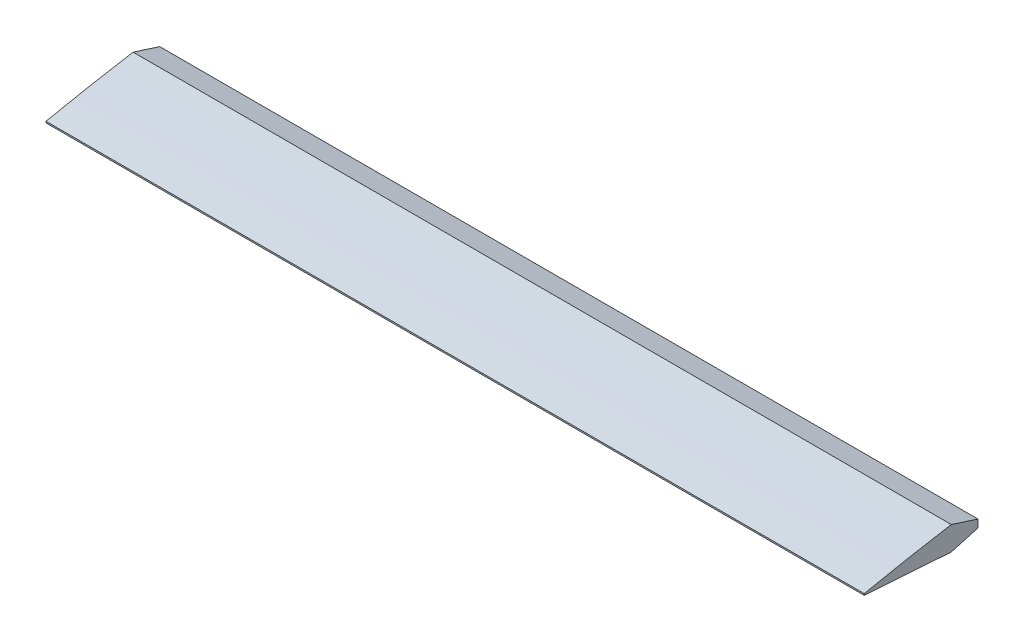
from build123d import *

# Parameters (mm, degrees)
EXTERIOR_DEPTH          = 89
BOSS_EXTRUDE1_DEPTH     = 15
CUT_EXTRUDE1_DEPTH      = 187.402789831
BOSS_EXTRUDE2_DEPTH     = 170
CUT_EXTRUDE6_DEPTH      = 195.066998874
CUT_EXTRUDE2_DEPTH      = 194.966819744
CUT_EXTRUDE2_DEPTH_BACK = 194.966819744
SKETCH13_R              = 3.25
SKETCH19_W              = 37
SKETCH19_H              = 36
CUT_EXTRUDE7_DEPTH      = 23
CUT_EXTRUDE8_DEPTH      = 266.663791417
CUT_EXTRUDE9_DEPTH      = 158.83115621


with BuildPart() as part:
    # Sketch4 → Exterior (new body)
    with BuildSketch(Plane.XY):
        with BuildLine():
            Line((-30.310889132, 17.5), (30.310889132, 17.5))
            ThreePointArc((30.310889132, 17.5), (0, 35), (-30.310889132, 17.5))
        make_face()
    extrude(amount=EXTERIOR_DEPTH)

    # Sketch5 → Boss-Extrude1 (add)
    with BuildSketch(Plane(origin=(0, 0, 0), x_dir=(-1, 0, 0), z_dir=(0, 0, -1))):
        with BuildLine():
            Line((23.12466216, 17.5), (-23.12466216, 17.5))
            ThreePointArc((-23.12466216, 17.5), (0, 29), (23.12466216, 17.5))
        make_face()
    extrude(amount=BOSS_EXTRUDE1_DEPTH)

    # Sketch8 → Loft9 section 0
    with BuildSketch(Plane(origin=(80, 0, 0), x_dir=(0, 0, -1), z_dir=(1, 0, 0))):
        with BuildLine():
            Line((-89, 21.388673285), (-89, 21.157289024))
            add(Edge.make_bspline(
                [(-89, 21.388673285), (-87.517590216, 21.692439314), (-84.55666408, 22.299173554), (-78.629726947, 23.410490963), (-71.217063181, 24.641831569), (-62.315979948, 25.916239067), (-53.416365024, 26.979047829), (-44.512891772, 27.757252313), (-35.611446145, 28.284249753), (-28.184700481, 28.373454674), (-22.249157522, 28.127729724), (-17.793860325, 27.767671666), (-13.332938365, 27.197496306), (-9.62034211, 26.495369454), (-6.660587516, 25.701015566), (-4.416675535, 24.978830377), (-2.51552544, 24.137376162), (-0.875610556, 23.117206005), (0.554450875, 21.352966349), (-0.931001928, 19.802231536), (-2.540242561, 19.094955092), (-4.433028592, 18.557703614), (-6.669552992, 18.172492853), (-9.641153104, 17.843758377), (-13.350431468, 17.590735708), (-17.804318711, 17.489291467), (-22.255027214, 17.503428063), (-28.18850674, 17.634400274), (-35.606048519, 17.870077207), (-44.505998121, 18.280226492), (-53.403367011, 18.813318665), (-62.302244976, 19.367425301), (-71.202644497, 19.928300878), (-78.617203737, 20.444864827), (-84.55068004, 20.843300056), (-87.516825449, 21.052621243), (-89, 21.157289024)],
                knots=[0, 0, 0, 0, 0.02501249, 0.049959286, 0.099672925, 0.14920632, 0.198581097, 0.24780517, 0.296916575, 0.345952722, 0.370491626, 0.395091204, 0.419814796, 0.444798575, 0.457489819, 0.470406405, 0.483879409, 0.49126412, 0.503458853, 0.513609129, 0.520450991, 0.533235388, 0.545691039, 0.558031884, 0.582609167, 0.607134742, 0.63165208, 0.656174272, 0.705233949, 0.754320379, 0.803437364, 0.852566096, 0.901700994, 0.950848809, 0.975422717, 1, 1, 1, 1], degree=3))
        make_face()
    # Sketch9 → Loft9 section 1
    with BuildSketch(Plane(origin=(-80, 0, 0), x_dir=(0, 0, -1), z_dir=(1, 0, 0))):
        with BuildLine():
            Line((-89, 21.388673285), (-89, 21.157289024))
            add(Edge.make_bspline(
                [(-89, 21.388673285), (-87.517590216, 21.692439314), (-84.55666408, 22.299173554), (-78.629726947, 23.410490963), (-71.217063181, 24.641831569), (-62.315979948, 25.916239067), (-53.416365024, 26.979047829), (-44.512891772, 27.757252313), (-35.611446145, 28.284249753), (-28.184700481, 28.373454674), (-22.249157522, 28.127729724), (-17.793860325, 27.767671666), (-13.332938365, 27.197496306), (-9.62034211, 26.495369454), (-6.660587516, 25.701015566), (-4.416675535, 24.978830377), (-2.51552544, 24.137376162), (-0.875610556, 23.117206005), (0.554450875, 21.352966349), (-0.931001928, 19.802231536), (-2.540242561, 19.094955092), (-4.433028592, 18.557703614), (-6.669552992, 18.172492853), (-9.641153104, 17.843758377), (-13.350431468, 17.590735708), (-17.804318711, 17.489291467), (-22.255027214, 17.503428063), (-28.18850674, 17.634400274), (-35.606048519, 17.870077207), (-44.505998121, 18.280226492), (-53.403367011, 18.813318665), (-62.302244976, 19.367425301), (-71.202644497, 19.928300878), (-78.617203737, 20.444864827), (-84.55068004, 20.843300056), (-87.516825449, 21.052621243), (-89, 21.157289024)],
                knots=[0, 0, 0, 0, 0.02501249, 0.049959286, 0.099672925, 0.14920632, 0.198581097, 0.24780517, 0.296916575, 0.345952722, 0.370491626, 0.395091204, 0.419814796, 0.444798575, 0.457489819, 0.470406405, 0.483879409, 0.49126412, 0.503458853, 0.513609129, 0.520450991, 0.533235388, 0.545691039, 0.558031884, 0.582609167, 0.607134742, 0.63165208, 0.656174272, 0.705233949, 0.754320379, 0.803437364, 0.852566096, 0.901700994, 0.950848809, 0.975422717, 1, 1, 1, 1], degree=3))
        make_face()
    loft()

    # Sketch12 → Cut-Extrude1 (cut, through all)
    with BuildSketch(Plane(origin=(80, 0, 0), x_dir=(0, 0, -1), z_dir=(1, 0, 0))):
        with BuildLine():
            Line((-89, 21.388673285), (-97.240851338, 26.906548897))
            Line((-97.240851338, 26.906548897), (-90.292288108, 42.772216923))
            Line((-90.292288108, 42.772216923), (-30.113825381, 44.023328414))
            Line((-30.113825381, 44.023328414), (6.418630162, 38.518437853))
            Line((6.418630162, 38.518437853), (-0.009919735, 28.917510296))
            Line((-0.009919735, 28.917510296), (-30.620155213, 28.319719466))
            add(Edge.make_bspline(
                [(-89, 21.388673285), (-87.517590216, 21.692439314), (-84.55666408, 22.299173554), (-78.629726947, 23.410490963), (-71.217063181, 24.641831569), (-62.315979948, 25.916239067), (-53.416365024, 26.979047829), (-44.512891772, 27.757252313), (-36.914651442, 28.207095335), (-32.281666301, 28.310724955), (-30.620155213, 28.319719466)],
                knots=[0, 0, 0, 0, 0.02501249, 0.049959286, 0.099672925, 0.14920632, 0.198581097, 0.24780517, 0.296916575, 0.324376959, 0.324376959, 0.324376959, 0.324376959], degree=3))
        make_face()
    extrude(amount=-CUT_EXTRUDE1_DEPTH, mode=Mode.SUBTRACT)

    # Sketch17 → Boss-Extrude2 (add)
    with BuildSketch(Plane.ZY.offset(80)):
        with BuildLine():
            Line((89, 21.388673285), (89, 21.157289024))
            add(Edge.make_bspline(
                [(89, 21.388673285), (87.517590216, 21.692439314), (84.55666408, 22.299173554), (78.629726947, 23.410490963), (71.217063181, 24.641831569), (62.315979948, 25.916239067), (53.416365024, 26.979047829), (44.512891772, 27.757252313), (35.611446145, 28.284249753), (28.184700481, 28.373454674), (22.249157522, 28.127729724), (17.793860325, 27.767671666), (13.332938365, 27.197496306), (9.62034211, 26.495369454), (6.660587516, 25.701015566), (4.416675535, 24.978830377), (2.51552544, 24.137376162), (0.875610556, 23.117206005), (-0.554450875, 21.352966349), (0.931001928, 19.802231536), (2.540242561, 19.094955092), (4.433028592, 18.557703614), (6.669552992, 18.172492853), (9.641153104, 17.843758377), (13.350431468, 17.590735708), (17.804318711, 17.489291467), (22.255027214, 17.503428063), (28.18850674, 17.634400274), (35.606048519, 17.870077207), (44.505998121, 18.280226492), (53.403367011, 18.813318665), (62.302244976, 19.367425301), (71.202644497, 19.928300878), (78.617203737, 20.444864827), (84.55068004, 20.843300056), (87.516825449, 21.052621243), (89, 21.157289024)],
                knots=[0, 0, 0, 0, 0.02501249, 0.049959286, 0.099672925, 0.14920632, 0.198581097, 0.24780517, 0.296916575, 0.345952722, 0.370491626, 0.395091204, 0.419814796, 0.444798575, 0.457489819, 0.470406405, 0.483879409, 0.49126412, 0.503458853, 0.513609129, 0.520450991, 0.533235388, 0.545691039, 0.558031884, 0.582609167, 0.607134742, 0.63165208, 0.656174272, 0.705233949, 0.754320379, 0.803437364, 0.852566096, 0.901700994, 0.950848809, 0.975422717, 1, 1, 1, 1], degree=3))
        make_face()
    extrude(amount=BOSS_EXTRUDE2_DEPTH)

    # Sketch18 → Cut-Extrude6 (cut, through all)
    with BuildSketch(Plane(origin=(-80, 0, 0), x_dir=(0, 0, -1), z_dir=(1, 0, 0))):
        Polygon((-99.866971184, 5.715372229), (-104.390100049, 63.325750406), (31.898914441, 60.82612656), (39.278756274, -3.211855795), align=None)
    extrude(amount=CUT_EXTRUDE6_DEPTH, mode=Mode.SUBTRACT)

    # Sketch13 → Cut-Extrude2 (cut, two sides: drawn at the far end of the back side and taken through both)
    with BuildSketch(Plane.ZY.offset(80).offset(-CUT_EXTRUDE2_DEPTH_BACK)):
        with Locations((20, 22.719194586)):
            Circle(SKETCH13_R)
    extrude(amount=CUT_EXTRUDE2_DEPTH + CUT_EXTRUDE2_DEPTH_BACK, mode=Mode.SUBTRACT)

    # Sketch19 → Cut-Extrude7 (cut)
    with BuildSketch(Plane(origin=(0, 0, 0), x_dir=(1, 0, 0), z_dir=(0, 1, 0))):
        with Locations((-165, -44.499999014)):
            Rectangle(SKETCH19_W, SKETCH19_H)
    extrude(amount=CUT_EXTRUDE7_DEPTH, mode=Mode.SUBTRACT)

    # Sketch20 → Cut-Extrude8 (cut, through all)
    with BuildSketch(Plane(origin=(0, 30, 0), x_dir=(1, 0, 0), z_dir=(0, 1, 0))):
        Polygon((-229, -89), (-229, -71.2), (-101, -71.2), (-101, -89), (-80, -89), (-80, 9.86e-07), (-250, 9.86e-07), (-250, -89), align=None)
    extrude(amount=-CUT_EXTRUDE8_DEPTH, mode=Mode.SUBTRACT)

    # Sketch21 → Cut-Extrude9 (cut, through all)
    with BuildSketch(Plane.ZY.offset(229)):
        Polygon((71.2, 21.393059344), (75.375229723, 20.21996412), (73.984331798, 18.552115167), (70.157731677, 19.386039644), align=None)
        Polygon((71.2, 22.597546397), (75.375229723, 23.941639457), (72.849168125, 25.747588121), (69.809858939, 24.557497175), align=None)
    extrude(amount=-CUT_EXTRUDE9_DEPTH, mode=Mode.SUBTRACT)


solid = part.part
